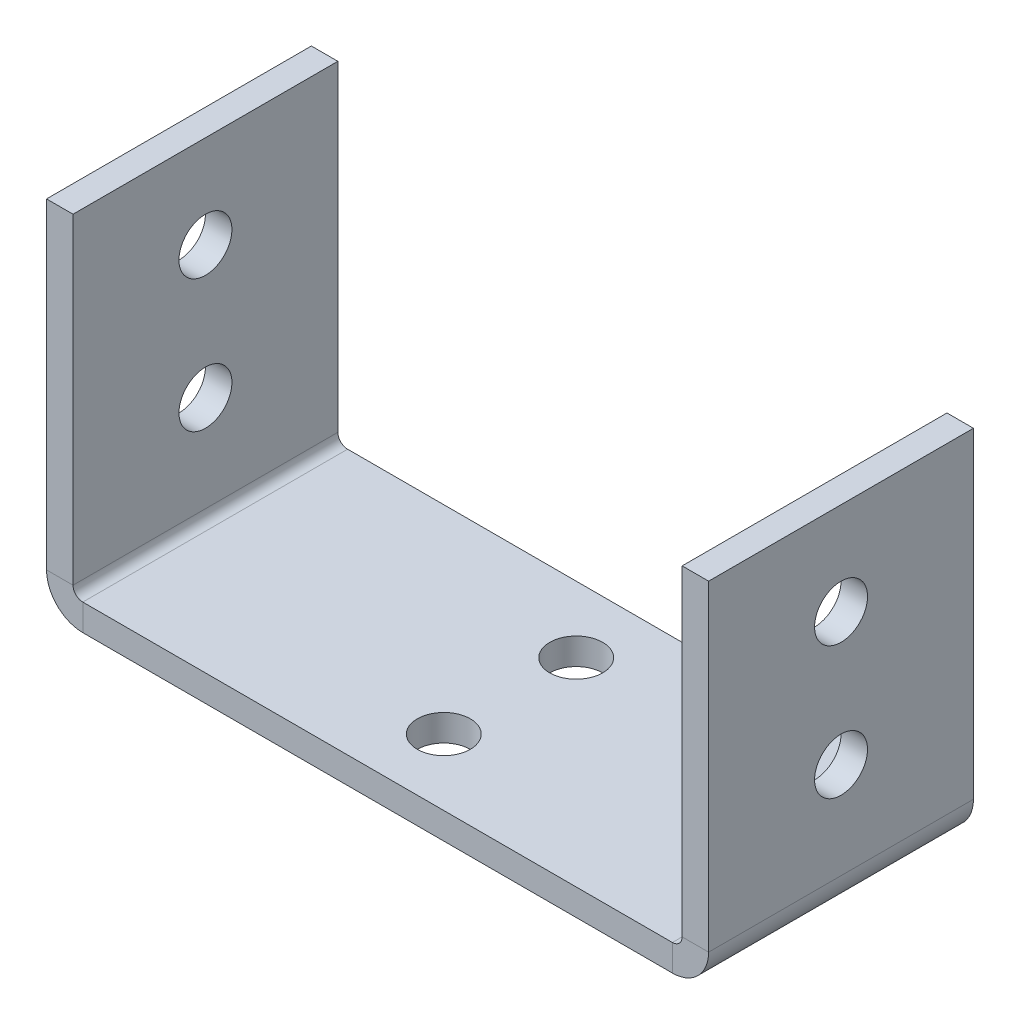
from build123d import *

# Parameters (mm, degrees)
SKETCH_1_W                       = 50
SKETCH_1_H                       = 20
SM_BASE_FLANGE_1_DEPTH           = 2
SM_EDGE_FLANGE_1_STRIP_W         = 9.4732
SM_EDGE_FLANGE_1_STRIP_H         = 2
SM_EDGE_FLANGE_1_STRIP_CUT_DEPTH = 20
SM_EDGE_FLANGE_1_DEPTH           = 20
SM_EDGE_FLANGE_2_STRIP_W         = 9.4732
SM_EDGE_FLANGE_2_STRIP_H         = 2
SM_EDGE_FLANGE_2_STRIP_CUT_DEPTH = 20
SM_EDGE_FLANGE_2_DEPTH           = 20
SKETCH_12_R                      = 2
CUT_EXTRUDE_1_DEPTH              = 2
CUT_EXTRUDE_2_REACH              = 61.372
SKETCH_13_R                      = 2


# Sheet-metal steps are written as plain solids
with BuildPart() as part:
    # Sketch 1 → Базовая кромка1 (new body)
    with BuildSketch(Plane(origin=(0, 0, 0), x_dir=(1, 0, 0), z_dir=(0, 1, 0))):
        with Locations((25, 10)):
            Rectangle(SKETCH_1_W, SKETCH_1_H)
    extrude(amount=-SM_BASE_FLANGE_1_DEPTH)

    # Ребро-кромка1 strip (across the edge) → Ребро-кромка1 strip cut (cut)
    with BuildSketch(Plane(origin=(50, 0, 0), x_dir=(-1, 0, 0), z_dir=(0, 0, -1))):
        with Locations((-2, -1)):
            Rectangle(SM_EDGE_FLANGE_1_STRIP_W, SM_EDGE_FLANGE_1_STRIP_H)
    extrude(amount=SM_EDGE_FLANGE_1_STRIP_CUT_DEPTH, mode=Mode.SUBTRACT)

    # Ребро-кромка1 section (across the edge) → Ребро-кромка1 (add)
    with BuildSketch(Plane(origin=(50, 0, 0), x_dir=(-1, 0, 0), z_dir=(0, 0, -1))):
        with BuildLine():
            Line((0, 0.7366), (0, 25))
            Line((0, 25), (2, 25))
            Line((2, 25), (2, 0.7366))
            ThreePointArc((2, 0.7366), (2.215745145, 0.215745145), (2.7366, 0))
            Line((2.7366, 0), (2.7366, -2))
            ThreePointArc((2.7366, -2), (0.801531583, -1.198468417), (0, 0.7366))
        make_face()
    extrude(amount=SM_EDGE_FLANGE_1_DEPTH)

    # Ребро-кромка2 strip (across the edge) → Ребро-кромка2 strip cut (cut)
    with BuildSketch(Plane.XY.offset(-20)):
        with Locations((-2, -1)):
            Rectangle(SM_EDGE_FLANGE_2_STRIP_W, SM_EDGE_FLANGE_2_STRIP_H)
    extrude(amount=SM_EDGE_FLANGE_2_STRIP_CUT_DEPTH, mode=Mode.SUBTRACT)

    # Ребро-кромка2 section (across the edge) → Ребро-кромка2 (add)
    with BuildSketch(Plane.XY.offset(-20)):
        with BuildLine():
            Line((0, 0.7366), (0, 25))
            Line((0, 25), (2, 25))
            Line((2, 25), (2, 0.7366))
            ThreePointArc((2, 0.7366), (2.215745145, 0.215745145), (2.7366, 0))
            Line((2.7366, 0), (2.7366, -2))
            ThreePointArc((2.7366, -2), (0.801531583, -1.198468417), (0, 0.7366))
        make_face()
    extrude(amount=SM_EDGE_FLANGE_2_DEPTH)

    # Эскиз12 → Вырез-Вытянуть1 (cut)
    with BuildSketch(Plane.XZ.offset(2)):
        with Locations(Location((25, -5, 0), (0, 0, 270))):
            Circle(SKETCH_12_R)
        with Locations(Location((25, -15, 0), (0, 0, 270))):
            Circle(SKETCH_12_R)
    extrude(amount=-CUT_EXTRUDE_1_DEPTH, mode=Mode.SUBTRACT)

    # Вырез-Вытянуть2: up to this face of the body (flat: up to its plane)
    cut_extrude_2_end = Plane(part.part.faces().sort_by_distance((0, 12.8683, -10))[0])
    # Эскиз13 → Вырез-Вытянуть2 (cut, up to the picked face)
    with BuildSketch(Plane(origin=(50, 0, 0), x_dir=(0, 0, -1), z_dir=(1, 0, 0)), mode=Mode.PRIVATE) as cut_extrude_2_sk1:
        with Locations(Location((10, 8, 0), (0, 0, 90))):
            Circle(SKETCH_13_R)
    cut_extrude_2_tool1 = split(extrude(cut_extrude_2_sk1.sketch, amount=-CUT_EXTRUDE_2_REACH, mode=Mode.PRIVATE), bisect_by=cut_extrude_2_end, keep=Keep.BOTH, mode=Mode.PRIVATE)
    # Эскиз13 → Вырез-Вытянуть2 (cut, up to the picked face)
    with BuildSketch(Plane(origin=(50, 0, 0), x_dir=(0, 0, -1), z_dir=(1, 0, 0)), mode=Mode.PRIVATE) as cut_extrude_2_sk2:
        with Locations(Location((10, 18, 0), (0, 0, 90))):
            Circle(SKETCH_13_R)
    cut_extrude_2_tool2 = split(extrude(cut_extrude_2_sk2.sketch, amount=-CUT_EXTRUDE_2_REACH, mode=Mode.PRIVATE), bisect_by=cut_extrude_2_end, keep=Keep.BOTH, mode=Mode.PRIVATE)
    add(cut_extrude_2_tool1.solids().sort_by(Axis((50, 8, -10), (-1, 0, 0)))[0], mode=Mode.SUBTRACT)
    add(cut_extrude_2_tool2.solids().sort_by(Axis((50, 18, -10), (-1, 0, 0)))[0], mode=Mode.SUBTRACT)


solid = part.part
